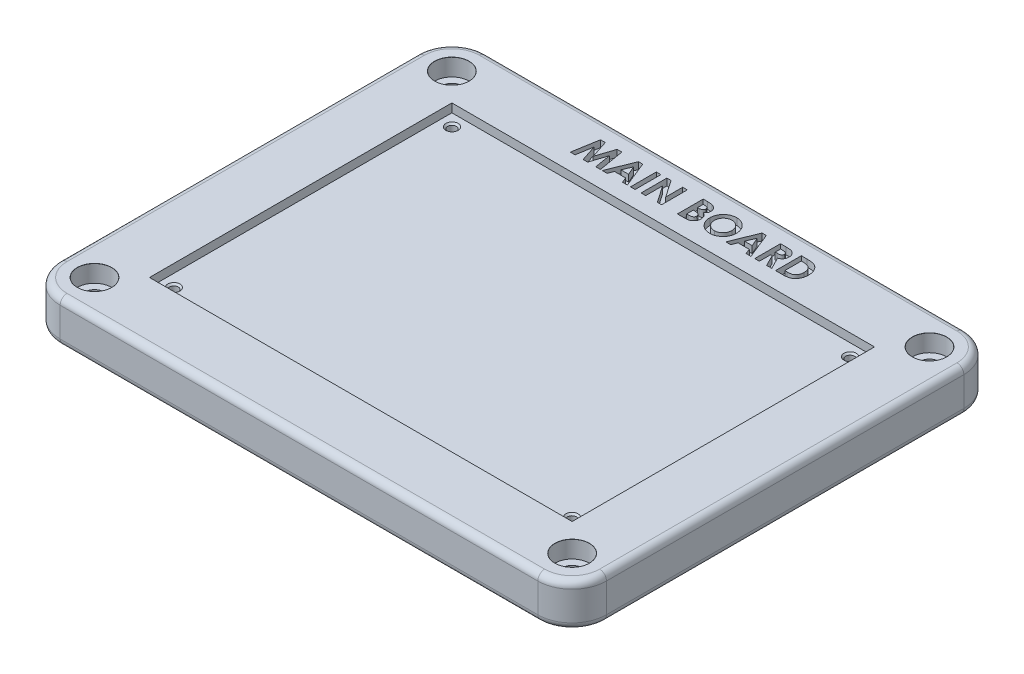
from build123d import *

# Parameters (mm, degrees)
SKETCH1_W           = 123
SKETCH1_H           = 88
SKETCH1_R           = 1.275
BOSS_EXTRUDE1_DEPTH = 10
SKETCH1_3_W         = 159
SKETCH1_3_H         = 124
SKETCH1_3_W_2       = 123
SKETCH1_3_H_2       = 88
BOSS_EXTRUDE2_DEPTH = 12.5
FILLET1_R           = 10
FILLET2_R           = 2
SKETCH4_W           = 1.346153846
SKETCH4_H           = 7.5
CUT_EXTRUDE1_DEPTH  = 2
CHAMFER1_SIZE       = 0.5


# Read off the part's stored shape, not the designer's step: CBORE for M5 SHCS1
with BuildPart() as part:
    # Sketch1 → Boss-Extrude1 (new body)
    with BuildSketch(Plane(origin=(0, 0, 0), x_dir=(1, 0, 0), z_dir=(0, 1, 0))):
        Rectangle(SKETCH1_W, SKETCH1_H)
        with Locations(Location((57.925, 40.475, 0), (0, 0, 270))):
            Circle(SKETCH1_R, mode=Mode.SUBTRACT)
        with Locations(Location((-57.925, 40.475, 0), (0, 0, 270))):
            Circle(SKETCH1_R, mode=Mode.SUBTRACT)
        with Locations(Location((-57.925, -40.475, 0), (0, 0, 270))):
            Circle(SKETCH1_R, mode=Mode.SUBTRACT)
        with Locations(Location((57.925, -40.475, 0), (0, 0, 270))):
            Circle(SKETCH1_R, mode=Mode.SUBTRACT)
    extrude(amount=BOSS_EXTRUDE1_DEPTH)

    # Sketch1<3> → Boss-Extrude2 (add)
    with BuildSketch(Plane(origin=(0, 0, 0), x_dir=(1, 0, 0), z_dir=(0, 1, 0))):
        Rectangle(SKETCH1_3_W, SKETCH1_3_H)
        Rectangle(SKETCH1_3_W_2, SKETCH1_3_H_2, mode=Mode.SUBTRACT)
    extrude(amount=BOSS_EXTRUDE2_DEPTH)

    # CBORE for M5 SHCS1 outline → CBORE for M5 SHCS1 (revolve, cut)
    with BuildSketch(Plane(origin=(69.5, 0, 52), x_dir=(1, 0, 0), z_dir=(0, 0, 1))):
        Polygon((0, 0), (2.75, 0), (2.75, 7.5), (5, 7.5), (5, 12.475), (5.025, 12.5), (0, 12.5), align=None)
    revolve(axis=Axis((69.5, 0, 52), (0, 1, 0)), mode=Mode.SUBTRACT)

    # CBORE for M5 SHCS1 2 outline → CBORE for M5 SHCS1 2 (revolve, cut)
    with BuildSketch(Plane(origin=(-69.5, 0, -52), x_dir=(1, 0, 0), z_dir=(0, 0, 1))):
        Polygon((0, 12.5), (0, 0), (2.75, 0), (2.75, 7.5), (5, 7.5), (5, 12.475), (5.025, 12.5), align=None)
    revolve(axis=Axis((-69.5, 0, -52), (0, 1, 0)), mode=Mode.SUBTRACT)

    # CBORE for M5 SHCS1 3 outline → CBORE for M5 SHCS1 3 (revolve, cut)
    with BuildSketch(Plane(origin=(-69.5, 0, 52), x_dir=(1, 0, 0), z_dir=(0, 0, 1))):
        Polygon((0, 12.5), (0, 0), (2.75, 0), (2.75, 7.5), (5, 7.5), (5, 12.475), (5.025, 12.5), align=None)
    revolve(axis=Axis((-69.5, 0, 52), (0, 1, 0)), mode=Mode.SUBTRACT)

    # CBORE for M5 SHCS1 4 outline → CBORE for M5 SHCS1 4 (revolve, cut)
    with BuildSketch(Plane(origin=(69.5, 0, -52), x_dir=(1, 0, 0), z_dir=(0, 0, 1))):
        Polygon((0, 12.5), (0, 0), (2.75, 0), (2.75, 7.5), (5, 7.5), (5, 12.475), (5.025, 12.5), align=None)
    revolve(axis=Axis((69.5, 0, -52), (0, 1, 0)), mode=Mode.SUBTRACT)

    # Fillet1
    fillet1_edges = [part.edges().sort_by_distance(p)[0] for p in [
        (-79.5, 6.25, 62),
        (79.5, 6.25, 62),
        (79.5, 6.25, -62),
        (-79.5, 6.25, -62),
    ]]
    fillet(fillet1_edges, radius=FILLET1_R)

    # Fillet2
    fillet2_edges = [part.edges().sort_by_distance(p)[0] for p in [
        (0, 12.5, 62),
        (0, 12.5, -62),
        (-79.5, 12.5, 0),
        (-76.571067812, 12.5, 59.071067812),
        (-76.571067812, 12.5, -59.071067812),
        (76.571067812, 12.5, -59.071067812),
        (76.571067812, 12.5, 59.071067812),
        (79.5, 0, 0),
        (79.5, 12.5, 0),
        (0, 0, 62),
        (-79.5, 0, 0),
        (0, 0, -62),
        (-76.571067812, 0, 59.071067812),
        (-76.571067812, 0, -59.071067812),
        (76.571067812, 0, -59.071067812),
        (76.571067812, 0, 59.071067812),
    ]]
    fillet(fillet2_edges, radius=FILLET2_R)

    # Sketch4 → Cut-Extrude1 (cut)
    # profile 1 of 9: a face of its own
    with BuildSketch(Plane(origin=(0, 12.5, 0), x_dir=(1, 0, 0), z_dir=(0, 1, 0))):
        Polygon((-30.584937428, 56.338544562), (-29.187701851, 56.338544562), (-27.47646387, 51.10717437), (-25.753206659, 56.338544562), (-24.369492717, 56.338544562), (-23.10146387, 48.838544562), (-24.464144159, 48.838544562), (-25.264925409, 53.575623889), (-26.824420601, 48.838544562), (-28.137521563, 48.838544562), (-29.688002332, 53.575623889), (-30.487281178, 48.838544562), (-31.85146387, 48.838544562), align=None)
    # profile 2 of 9: a face of its own
    with BuildSketch(Plane(origin=(0, 12.5, 0), x_dir=(1, 0, 0), z_dir=(0, 1, 0))):
        Polygon((-19.542269159, 56.338544562), (-18.293771563, 56.338544562), (-15.264925409, 48.838544562), (-16.70272589, 48.838544562), (-17.285658582, 50.377006101), (-20.553386947, 50.377006101), (-21.13631964, 48.838544562), (-22.572617717, 48.838544562), align=None)
        Polygon((-18.918771563, 54.326825812), (-20.04256964, 51.723159947), (-17.794973486, 51.723159947), align=None, mode=Mode.SUBTRACT)
    # profile 3 of 9: a face of its own
    with BuildSketch(Plane(origin=(0, 12.5, 0), x_dir=(1, 0, 0), z_dir=(0, 1, 0))):
        with Locations((-13.678386947, 52.588544562)):
            Rectangle(SKETCH4_W, SKETCH4_H)
    # profile 4 of 9: a face of its own
    with BuildSketch(Plane(origin=(0, 12.5, 0), x_dir=(1, 0, 0), z_dir=(0, 1, 0))):
        Polygon((-11.274540794, 56.338544562), (-10.06210089, 56.338544562), (-6.659156178, 51.403147928), (-6.659156178, 56.338544562), (-5.313002332, 56.338544562), (-5.313002332, 48.838544562), (-6.534456659, 48.838544562), (-9.928386947, 53.758917159), (-9.928386947, 48.838544562), (-11.274540794, 48.838544562), align=None)
    # profile 5 of 9: a face of its own
    with BuildSketch(Plane(origin=(0, 12.5, 0), x_dir=(1, 0, 0), z_dir=(0, 1, 0))):
        with BuildLine():
            Line((-0.697617717, 48.838544562), (-0.697617717, 56.338544562))
            Line((-0.697617717, 56.338544562), (0.50430536, 56.338544562))
            add(Edge.make_bspline(
                [(0.50430536, 56.338544562), (0.588447491, 56.338554165), (0.751260919, 56.338572746), (0.986158204, 56.330323925), (1.204005599, 56.31965315), (1.404109828, 56.307715035), (1.586811483, 56.287143276), (1.751832735, 56.26546289), (1.899503299, 56.239317681), (1.990799984, 56.215864619), (2.033752476, 56.20483062)],
                knots=[0, 0, 0, 0, 1.311965854, 2.538629056, 3.664479157, 4.713267157, 5.663616078, 6.530575999, 7.308677837, 8, 8, 8, 8], degree=3))
            add(Edge.make_bspline(
                [(2.033752476, 56.20483062), (2.090153458, 56.189266969), (2.200830292, 56.158726089), (2.359354837, 56.097047461), (2.509737481, 56.028487294), (2.651794611, 55.950272966), (2.784653939, 55.861460211), (2.907810555, 55.761344185), (3.023920642, 55.65394354), (3.128861396, 55.53626505), (3.223710548, 55.411915928), (3.306117455, 55.280928754), (3.377718495, 55.14530641), (3.435018081, 55.003342178), (3.478192244, 54.855689841), (3.509769646, 54.702979898), (3.530236078, 54.544729137), (3.532169887, 54.437065972), (3.533151514, 54.382414755)],
                knots=[0, 0, 0, 0, 1.099996261, 2.158545794, 3.195537121, 4.207578794, 5.205712374, 6.197378256, 7.190519799, 8.17788031, 9.159561366, 10.129234751, 11.085776129, 12.040971148, 13.00380137, 13.975669004, 14.972423361, 16, 16, 16, 16], degree=3))
            add(Edge.make_bspline(
                [(3.533151514, 54.382414755), (3.530584852, 54.312202286), (3.525532693, 54.173997667), (3.493259155, 53.971000086), (3.432741244, 53.779138194), (3.353555029, 53.59487605), (3.245886533, 53.418900952), (3.109168367, 53.251296571), (2.945614917, 53.086902118), (2.820160393, 52.988358732), (2.754906322, 52.937102255)],
                knots=[0, 0, 0, 0, 0.986156485, 1.941127874, 2.875419072, 3.804401753, 4.751181392, 5.761612777, 6.835722519, 8, 8, 8, 8], degree=3))
            add(Edge.make_bspline(
                [(2.754906322, 52.937102255), (2.80778509, 52.910108102), (2.911465725, 52.857180037), (3.058661768, 52.770182098), (3.194949235, 52.677648756), (3.320939199, 52.581441819), (3.433988877, 52.477482937), (3.538766278, 52.371762361), (3.630102231, 52.258222744), (3.711777592, 52.140910853), (3.782768489, 52.018127999), (3.844593732, 51.890081534), (3.896815297, 51.756334023), (3.941037869, 51.617566133), (3.974019075, 51.473300567), (3.995523522, 51.323485731), (4.011988672, 51.168632568), (4.013269505, 51.063150461), (4.013920745, 51.00951812)],
                knots=[0, 0, 0, 0, 1.164658916, 2.283573913, 3.35186032, 4.395461096, 5.390182219, 6.362969632, 7.312859996, 8.245001507, 9.165155236, 10.092416118, 11.032087915, 11.979892451, 12.947605196, 13.931445124, 14.948243989, 16, 16, 16, 16], degree=3))
            add(Edge.make_bspline(
                [(4.013920745, 51.00951812), (4.009694636, 50.907083415), (4.001354426, 50.704928936), (3.940374881, 50.408119733), (3.834655727, 50.126717688), (3.692696703, 49.861841213), (3.517775872, 49.621158048), (3.316667079, 49.410321684), (3.091395026, 49.231853383), (2.88355433, 49.111401125), (2.703788496, 49.030566396), (2.554891814, 48.980589269), (2.394979933, 48.934290534), (2.221123653, 48.901778606), (2.03647475, 48.872020115), (1.839232886, 48.853646606), (1.629766702, 48.841195332), (1.485896272, 48.839446016), (1.411757283, 48.838544562)],
                knots=[0, 0, 0, 0, 1.284142165, 2.534249414, 3.780121997, 5.041676246, 6.291546858, 7.49970053, 8.684500223, 9.883330709, 10.50184324, 11.153274765, 11.851151195, 12.587658647, 13.369265475, 14.195992086, 15.070362669, 16, 16, 16, 16], degree=3))
            Line((1.411757283, 48.838544562), (-0.697617717, 48.838544562))
        make_face()
        with BuildLine():
            Line((0.64853613, 54.992390716), (0.64853613, 53.357775332))
            Line((0.64853613, 53.357775332), (1.006108245, 53.357775332))
            add(Edge.make_bspline(
                [(1.006108245, 53.357775332), (1.054705508, 53.358199118), (1.148519583, 53.359017212), (1.284024064, 53.369553982), (1.410021348, 53.387530366), (1.526033555, 53.412611943), (1.63314138, 53.444461889), (1.730660588, 53.482784233), (1.818162404, 53.529541658), (1.919819277, 53.599188907), (2.027277922, 53.701677951), (2.121872559, 53.849744611), (2.177588169, 54.020020706), (2.183793385, 54.140112592), (2.186997668, 54.202126293)],
                knots=[0, 0, 0, 0, 1.065314748, 2.056525647, 2.977365736, 3.853934255, 4.656397591, 5.425096493, 6.14721249, 6.826394842, 8.123232004, 9.372140726, 10.643011755, 12, 12, 12, 12], degree=3))
            add(Edge.make_bspline(
                [(2.186997668, 54.202126293), (2.184433655, 54.260212428), (2.179476238, 54.372519634), (2.123377783, 54.530208954), (2.036245792, 54.669953964), (1.933374229, 54.765597995), (1.836500663, 54.830920049), (1.753551571, 54.873931839), (1.662508714, 54.912435554), (1.5616096, 54.941876434), (1.451430418, 54.963967833), (1.332506369, 54.98019132), (1.204632269, 54.991233715), (1.116309356, 54.991996777), (1.07071161, 54.992390716)],
                knots=[0, 0, 0, 0, 1.347982417, 2.606269829, 3.849316587, 5.153353503, 5.842674298, 6.568177932, 7.326619318, 8.142485038, 9.012069166, 9.942760135, 10.937925643, 12, 12, 12, 12], degree=3))
            Line((1.07071161, 54.992390716), (0.64853613, 54.992390716))
        make_face(mode=Mode.SUBTRACT)
        with BuildLine():
            Line((0.64853613, 52.107775332), (0.64853613, 50.184698409))
            Line((0.64853613, 50.184698409), (1.036156322, 50.184698409))
            add(Edge.make_bspline(
                [(1.036156322, 50.184698409), (1.112789327, 50.18513621), (1.260125843, 50.185977938), (1.471185141, 50.196148015), (1.663090807, 50.214477785), (1.835334365, 50.237361028), (1.988179638, 50.268364242), (2.121109971, 50.307780855), (2.235948333, 50.351145995), (2.332006147, 50.404707092), (2.410479878, 50.467038927), (2.481294192, 50.530743559), (2.539031772, 50.604232871), (2.584714822, 50.68435217), (2.624253422, 50.769111235), (2.648100313, 50.861819877), (2.666256499, 50.959730434), (2.667255682, 51.027453049), (2.667766899, 51.062102255)],
                knots=[0, 0, 0, 0, 1.753078804, 3.370512758, 4.83203934, 6.162291463, 7.344201807, 8.395507345, 9.331626367, 10.147333109, 10.898971645, 11.62040215, 12.321813352, 13.025280112, 13.727906689, 14.453419512, 15.208716525, 16, 16, 16, 16], degree=3))
            add(Edge.make_bspline(
                [(2.667766899, 51.062102255), (2.66663952, 51.101724167), (2.664443689, 51.178896993), (2.64651031, 51.291693314), (2.613919503, 51.396996164), (2.572869791, 51.497498279), (2.515746936, 51.589601332), (2.447858376, 51.676492662), (2.365831663, 51.755229859), (2.27358784, 51.830575244), (2.165994552, 51.89654421), (2.043001321, 51.953783974), (1.90393998, 52.001588517), (1.748379773, 52.039650525), (1.577002662, 52.071953225), (1.388557783, 52.091241503), (1.184614571, 52.105587043), (1.043197029, 52.107029328), (0.970050553, 52.107775332)],
                knots=[0, 0, 0, 0, 0.845221588, 1.646264278, 2.427170338, 3.19324141, 3.95557735, 4.731569926, 5.540061037, 6.376114724, 7.268642756, 8.224665384, 9.265483498, 10.400594375, 11.639216012, 12.983232105, 14.439614077, 16, 16, 16, 16], degree=3))
            Line((0.970050553, 52.107775332), (0.64853613, 52.107775332))
        make_face(mode=Mode.SUBTRACT)
    # profile 6 of 9: a face of its own
    with BuildSketch(Plane(origin=(0, 12.5, 0), x_dir=(1, 0, 0), z_dir=(0, 1, 0))):
        with BuildLine():
            add(Edge.make_bspline(
                [(8.884714014, 56.530852255), (9.015110706, 56.527476051), (9.27254331, 56.52081066), (9.651133772, 56.465249423), (10.015975683, 56.374720352), (10.366904064, 56.248878397), (10.703040229, 56.084315116), (11.025569843, 55.885695987), (11.33333762, 55.649272194), (11.623189804, 55.380559112), (11.891065497, 55.088345369), (12.123179942, 54.773725323), (12.321118626, 54.444851095), (12.485170736, 54.100841458), (12.610126953, 53.739313981), (12.697813899, 53.362111976), (12.754148418, 52.969342753), (12.760627754, 52.701920447), (12.763920745, 52.566008505)],
                knots=[0, 0, 0, 0, 1.014329547, 2.002516266, 2.970391464, 3.935626869, 4.897733899, 5.877609409, 6.878433252, 7.912639331, 8.949961323, 9.958554974, 10.949718813, 11.932905612, 12.9188844, 13.919928257, 14.942845884, 16, 16, 16, 16], degree=3))
            add(Edge.make_bspline(
                [(12.763920745, 52.566008505), (12.760413852, 52.431627976), (12.753503408, 52.166826832), (12.700113721, 51.777677133), (12.610950116, 51.404515747), (12.488113254, 51.046498015), (12.327036429, 50.705358054), (12.132957765, 50.378917731), (11.900755897, 50.07020649), (11.638900137, 49.779389999), (11.35061967, 49.51541163), (11.045284892, 49.282781149), (10.72430565, 49.085658858), (10.388151755, 48.924135049), (10.036102341, 48.798782369), (9.669027013, 48.710336945), (9.286948486, 48.656586875), (9.027116559, 48.649721568), (8.895230841, 48.64623687)],
                knots=[0, 0, 0, 0, 1.051557043, 2.072126891, 3.067553643, 4.050577992, 5.02905126, 6.015227836, 7.017913613, 8.04756643, 9.074058332, 10.072836633, 11.047628519, 12.017157415, 12.98668631, 13.966869689, 14.968021931, 16, 16, 16, 16], degree=3))
            add(Edge.make_bspline(
                [(8.895230841, 48.64623687), (8.757294194, 48.649362816), (8.486267537, 48.655504873), (8.089618811, 48.713913029), (7.709595058, 48.801896115), (7.349388697, 48.93320615), (7.005331333, 49.097354737), (6.679950858, 49.299513562), (6.373356619, 49.539348543), (6.087307293, 49.810717418), (5.828145911, 50.107654487), (5.599385156, 50.421342168), (5.406420385, 50.749384163), (5.249244537, 51.091934003), (5.125333412, 51.446862825), (5.037928193, 51.816332246), (4.986295844, 52.199456145), (4.979103757, 52.459681556), (4.975459206, 52.59154937)],
                knots=[0, 0, 0, 0, 1.067978421, 2.098431617, 3.099715153, 4.085208694, 5.062210972, 6.048429807, 7.046490867, 8.072918869, 9.098532598, 10.095778865, 11.076610158, 12.041847152, 13.011192615, 13.984257998, 14.978533688, 16, 16, 16, 16], degree=3))
            add(Edge.make_bspline(
                [(4.975459206, 52.59154937), (4.976603076, 52.680263132), (4.978876332, 52.856567336), (5.006260095, 53.117841167), (5.045684839, 53.374015283), (5.103992166, 53.624068315), (5.174820665, 53.86976427), (5.266588991, 54.108816151), (5.371046181, 54.343777687), (5.493094572, 54.57187369), (5.628800581, 54.791005485), (5.77686792, 55.00013939), (5.937668902, 55.19674667), (6.110685532, 55.382119346), (6.296514051, 55.555038952), (6.492710075, 55.717953404), (6.703078666, 55.866535116), (6.923015514, 56.004412748), (7.151280667, 56.129093101), (7.386944878, 56.235217288), (7.625152999, 56.327893733), (7.86908717, 56.401038081), (8.1161332, 56.460613387), (8.368930278, 56.50001156), (8.625194526, 56.527394564), (8.798002221, 56.529696956), (8.884714014, 56.530852255)],
                knots=[0, 0, 0, 0, 1.034744296, 2.056386356, 3.06226378, 4.057406941, 5.050368692, 6.043467995, 7.042652155, 8.049140477, 9.059438543, 10.048523776, 11.036952808, 12.020949711, 13.004946614, 13.997082645, 14.994316842, 16.007702937, 17.024872941, 18.026463647, 19.021641123, 20.005082605, 20.995858141, 21.984425357, 22.988620895, 24, 24, 24, 24], degree=3))
        make_face()
        with BuildLine():
            add(Edge.make_bspline(
                [(8.86368036, 55.184698409), (8.775923404, 55.182343692), (8.602726289, 55.177696425), (8.348677664, 55.142290533), (8.104782013, 55.085743298), (7.872391344, 55.003835319), (7.650498458, 54.899587251), (7.438710006, 54.773363349), (7.23995882, 54.620824806), (7.051594747, 54.450160738), (6.881438802, 54.260001746), (6.731100658, 54.056214045), (6.605291845, 53.839137958), (6.499926176, 53.610790071), (6.42060918, 53.368602673), (6.364114062, 53.114472842), (6.328411256, 52.847962702), (6.323910873, 52.666283086), (6.321613053, 52.573520524)],
                knots=[0, 0, 0, 0, 1.033739768, 2.040188636, 3.016340934, 3.979330865, 4.937572243, 5.900995986, 6.878200029, 7.884839167, 8.891893314, 9.879764717, 10.863503415, 11.843163062, 12.837761627, 13.859916423, 14.907309254, 16, 16, 16, 16], degree=3))
            add(Edge.make_bspline(
                [(6.321613053, 52.573520524), (6.324659611, 52.470718739), (6.330630361, 52.269244274), (6.372641284, 51.975338752), (6.444517791, 51.697774157), (6.54830607, 51.437908015), (6.677030765, 51.192854708), (6.836886407, 50.965617712), (7.02528409, 50.754836438), (7.170424138, 50.631773551), (7.244089014, 50.569313793)],
                knots=[0, 0, 0, 0, 1.078454662, 2.113592447, 3.107694534, 4.079536787, 5.043276885, 6.005368276, 6.987637804, 8, 8, 8, 8], degree=3))
            add(Edge.make_bspline(
                [(7.244089014, 50.569313793), (7.304434611, 50.523170923), (7.423766208, 50.431924789), (7.614245418, 50.31497415), (7.810401496, 50.214735786), (8.013714688, 50.133744373), (8.223755605, 50.07003789), (8.440495445, 50.025425287), (8.663627106, 49.99742702), (8.814519191, 49.994080697), (8.89072363, 49.992390716)],
                knots=[0, 0, 0, 0, 1.023928204, 2.024787132, 3.009472467, 3.9914905, 4.972207045, 5.96565515, 6.972602802, 8, 8, 8, 8], degree=3))
            add(Edge.make_bspline(
                [(8.89072363, 49.992390716), (8.976971603, 49.994765398), (9.146667203, 49.999437659), (9.395986575, 50.034407685), (9.634842107, 50.093589596), (9.864716633, 50.174779048), (10.084947297, 50.280336041), (10.294457773, 50.410475013), (10.493615389, 50.563598026), (10.681739489, 50.736503287), (10.853693809, 50.927411374), (11.003718229, 51.132286058), (11.133527134, 51.346613334), (11.236701722, 51.573426681), (11.319152353, 51.810585087), (11.374967523, 52.059138875), (11.410971937, 52.318063412), (11.415473588, 52.49427071), (11.417766899, 52.584037351)],
                knots=[0, 0, 0, 0, 1.026359118, 2.019393844, 2.989460624, 3.950973911, 4.916101784, 5.890408035, 6.881132271, 7.902007068, 8.92769091, 9.933912415, 10.920395702, 11.90457117, 12.894218921, 13.903490204, 14.931958862, 16, 16, 16, 16], degree=3))
            add(Edge.make_bspline(
                [(11.417766899, 52.584037351), (11.415394239, 52.673287809), (11.41072402, 52.848963725), (11.375692445, 53.107222569), (11.31688585, 53.354679065), (11.235452594, 53.591737335), (11.131466638, 53.818629785), (11.002877455, 54.034558527), (10.850136248, 54.23931481), (10.676758346, 54.431503298), (10.488047155, 54.608112208), (10.285446836, 54.761376638), (10.074626373, 54.894558555), (9.850748517, 54.99888789), (9.618393619, 55.08200685), (9.37614384, 55.143216846), (9.123081642, 55.177447697), (8.950918196, 55.182259961), (8.86368036, 55.184698409)],
                knots=[0, 0, 0, 0, 1.055025985, 2.07665775, 3.074803781, 4.057872707, 5.035505728, 6.020516407, 7.023567878, 8.050795229, 9.077271434, 10.074415901, 11.050397877, 12.019801805, 12.988065821, 13.964604439, 14.968634123, 16, 16, 16, 16], degree=3))
        make_face(mode=Mode.SUBTRACT)
    # profile 7 of 9: a face of its own
    with BuildSketch(Plane(origin=(0, 12.5, 0), x_dir=(1, 0, 0), z_dir=(0, 1, 0))):
        Polygon((16.419269303, 56.338544562), (17.667766899, 56.338544562), (20.696613053, 48.838544562), (19.258812572, 48.838544562), (18.67587988, 50.377006101), (15.408151514, 50.377006101), (14.825218822, 48.838544562), (13.388920745, 48.838544562), align=None)
        Polygon((17.042766899, 54.326825812), (15.918968822, 51.723159947), (18.166564976, 51.723159947), align=None, mode=Mode.SUBTRACT)
    # profile 8 of 9: a face of its own
    with BuildSketch(Plane(origin=(0, 12.5, 0), x_dir=(1, 0, 0), z_dir=(0, 1, 0))):
        with BuildLine():
            Line((21.802382283, 56.338544562), (23.370891899, 56.338544562))
            add(Edge.make_bspline(
                [(23.370891899, 56.338544562), (23.474569907, 56.338176565), (23.673971921, 56.337468802), (23.961498734, 56.326302182), (24.225631654, 56.310762912), (24.466761752, 56.287049575), (24.684785869, 56.255608556), (24.879922518, 56.218544797), (25.052165992, 56.176302697), (25.20296893, 56.123665709), (25.339061124, 56.064291984), (25.465917969, 55.996070485), (25.586338116, 55.91976088), (25.699516687, 55.833355258), (25.806437229, 55.738408033), (25.907301455, 55.634823632), (26.000684059, 55.521723702), (26.086006813, 55.399822892), (26.163771636, 55.271586034), (26.232499429, 55.13683706), (26.288388984, 54.99548226), (26.337773398, 54.849564517), (26.373343391, 54.696997907), (26.398081801, 54.539267694), (26.416194297, 54.375818648), (26.417235679, 54.264778624), (26.417766899, 54.208135909)],
                knots=[0, 0, 0, 0, 1.749336639, 3.364467119, 4.854658419, 6.213483162, 7.451590619, 8.570285859, 9.5643256, 10.440900261, 11.26203566, 12.067320669, 12.869050712, 13.665104639, 14.467235401, 15.27997916, 16.102287765, 16.939272006, 17.78853747, 18.631303466, 19.488103222, 20.351255419, 21.228522269, 22.127379805, 23.044756219, 24, 24, 24, 24], degree=3))
            add(Edge.make_bspline(
                [(26.417766899, 54.208135909), (26.41638698, 54.149013926), (26.41368121, 54.033086493), (26.399106463, 53.86279855), (26.372468404, 53.699878957), (26.332121189, 53.544804722), (26.285747305, 53.395645767), (26.224081936, 53.255154167), (26.154486471, 53.121286676), (26.071829972, 52.995936899), (25.981118501, 52.876320568), (25.875622969, 52.767020628), (25.762177866, 52.662162622), (25.634406029, 52.568314498), (25.497939759, 52.479130587), (25.350067615, 52.398306212), (25.191754662, 52.323809637), (25.080452816, 52.2822652), (25.02353613, 52.261020524)],
                knots=[0, 0, 0, 0, 1.099860209, 2.156625411, 3.176576793, 4.16617041, 5.135385252, 6.078461593, 7.016046972, 7.938469504, 8.868247731, 9.803980173, 10.76021508, 11.73834243, 12.748633912, 13.790971185, 14.870363756, 16, 16, 16, 16], degree=3))
            Line((25.02353613, 52.261020524), (26.75430536, 48.838544562))
            Line((26.75430536, 48.838544562), (25.25791113, 48.838544562))
            Line((25.25791113, 48.838544562), (23.605266899, 52.107775332))
            Line((23.605266899, 52.107775332), (23.14853613, 52.107775332))
            Line((23.14853613, 52.107775332), (23.14853613, 48.838544562))
            Line((23.14853613, 48.838544562), (21.802382283, 48.838544562))
            Line((21.802382283, 48.838544562), (21.802382283, 56.338544562))
        make_face()
        with BuildLine():
            Line((23.14853613, 53.453929178), (23.672875072, 53.453929178))
            add(Edge.make_bspline(
                [(23.672875072, 53.453929178), (23.736979866, 53.454651169), (23.859726773, 53.456033627), (24.036252946, 53.462446041), (24.196580811, 53.47789679), (24.341398869, 53.497418234), (24.471435831, 53.519958561), (24.585531815, 53.552260217), (24.685444864, 53.586872259), (24.769991005, 53.629886049), (24.842225285, 53.678802058), (24.904594963, 53.73437186), (24.95618363, 53.798686829), (24.998643733, 53.869999164), (25.031673078, 53.948939602), (25.055781969, 54.034641559), (25.069255274, 54.128081288), (25.070805423, 54.192567424), (25.071613053, 54.226164755)],
                knots=[0, 0, 0, 0, 1.688639943, 3.233382647, 4.650958383, 5.928841754, 7.082724185, 8.122798841, 9.049171256, 9.863274652, 10.613301712, 11.341792392, 12.054588806, 12.776240173, 13.521029143, 14.301969904, 15.115324896, 16, 16, 16, 16], degree=3))
            add(Edge.make_bspline(
                [(25.071613053, 54.226164755), (25.070086156, 54.26591285), (25.067086849, 54.343990618), (25.037324412, 54.456395225), (24.98994904, 54.56043338), (24.925010382, 54.655635012), (24.843228584, 54.739095335), (24.749377519, 54.812666274), (24.641431653, 54.870840668), (24.541481905, 54.909211878), (24.450550997, 54.93216977), (24.36848872, 54.949277787), (24.273460111, 54.96140273), (24.165393426, 54.974263391), (24.044564131, 54.982602878), (23.910313636, 54.988689041), (23.763027505, 54.99117919), (23.660355083, 54.991975246), (23.606769303, 54.992390716)],
                knots=[0, 0, 0, 0, 1.020303359, 2.004196876, 2.966617323, 3.9489082, 4.950758222, 5.960522915, 7.003732012, 8.091992268, 8.70421221, 9.413913587, 10.24622431, 11.166358409, 12.212345909, 13.359657661, 14.621978493, 16, 16, 16, 16], degree=3))
            Line((23.606769303, 54.992390716), (23.14853613, 54.992390716))
            Line((23.14853613, 54.992390716), (23.14853613, 53.453929178))
        make_face(mode=Mode.SUBTRACT)
    # profile 9 of 9: a face of its own
    with BuildSketch(Plane(origin=(0, 12.5, 0), x_dir=(1, 0, 0), z_dir=(0, 1, 0))):
        with BuildLine():
            Line((27.860074591, 56.338544562), (29.556288533, 56.338544562))
            add(Edge.make_bspline(
                [(29.556288533, 56.338544562), (29.68852792, 56.337620164), (29.94414815, 56.335833291), (30.314491292, 56.315699531), (30.658863288, 56.284735237), (30.977486125, 56.242138239), (31.269706576, 56.185770746), (31.535147829, 56.115068773), (31.774700767, 56.033455109), (31.99099204, 55.937420071), (32.188445168, 55.825452754), (32.375933215, 55.700730152), (32.553088052, 55.558683313), (32.722395768, 55.402052601), (32.88167141, 55.227972507), (33.033567489, 55.039326428), (33.174364898, 54.833378735), (33.30831964, 54.615067404), (33.42946388, 54.383467253), (33.535130412, 54.140549614), (33.623647907, 53.887877753), (33.695572955, 53.625182387), (33.75290552, 53.353335584), (33.79301996, 53.071788784), (33.817819106, 52.780802652), (33.820334772, 52.583587063), (33.821613053, 52.483376293)],
                knots=[0, 0, 0, 0, 1.44355588, 2.790409838, 4.047694926, 5.217575253, 6.298404546, 7.294384826, 8.214239204, 9.058592145, 9.873746385, 10.689560431, 11.514393297, 12.350027578, 13.205127629, 14.088021785, 14.991911688, 15.926770944, 16.882954281, 17.842803888, 18.816321264, 19.80318086, 20.814351908, 21.847355356, 22.906180909, 24, 24, 24, 24], degree=3))
            add(Edge.make_bspline(
                [(33.821613053, 52.483376293), (33.818265824, 52.341972374), (33.81167661, 52.063610483), (33.756172745, 51.655117614), (33.666404202, 51.263536457), (33.540181477, 50.891930111), (33.383699088, 50.543607785), (33.196763351, 50.224711998), (32.982115179, 49.936954421), (32.742255238, 49.681767851), (32.482545339, 49.462431535), (32.212654383, 49.274586032), (31.92995314, 49.126454178), (31.680853837, 49.032516431), (31.464853664, 48.97409528), (31.275207849, 48.939567816), (31.059789553, 48.90790405), (30.816590189, 48.883434973), (30.546676617, 48.861614569), (30.248972961, 48.849758211), (29.924443099, 48.839907338), (29.699026426, 48.839010724), (29.581829399, 48.838544562)],
                knots=[0, 0, 0, 0, 1.315458931, 2.589557908, 3.828601765, 5.048913369, 6.235739168, 7.376350998, 8.481830359, 9.569842114, 10.627874879, 11.640079404, 12.624025415, 13.590060155, 14.111227486, 14.704434459, 15.382649715, 16.137166398, 16.978595427, 17.902333227, 18.909396075, 20, 20, 20, 20], degree=3))
            Line((29.581829399, 48.838544562), (27.860074591, 48.838544562))
            Line((27.860074591, 48.838544562), (27.860074591, 56.338544562))
        make_face()
        with BuildLine():
            Line((29.206228437, 54.992390716), (29.206228437, 50.184698409))
            Line((29.206228437, 50.184698409), (29.909353437, 50.184698409))
            add(Edge.make_bspline(
                [(29.909353437, 50.184698409), (29.993014514, 50.18485171), (30.153922615, 50.185146561), (30.38623749, 50.199190533), (30.601069845, 50.213286808), (30.797828295, 50.240042011), (30.977944788, 50.269845423), (31.138944995, 50.311320953), (31.284147829, 50.354887483), (31.411779666, 50.410353075), (31.52868003, 50.472783291), (31.636916415, 50.545927527), (31.741394829, 50.627151442), (31.840161966, 50.718843947), (31.933591635, 50.819790862), (32.021131046, 50.930512321), (32.10394862, 51.050670509), (32.179918587, 51.180900733), (32.249340349, 51.319827732), (32.31092523, 51.466105796), (32.361988185, 51.620953106), (32.404428587, 51.782920104), (32.434757066, 51.953416898), (32.459848098, 52.13118064), (32.472783256, 52.316915617), (32.474558526, 52.443295903), (32.475459206, 52.507414755)],
                knots=[0, 0, 0, 0, 1.50275155, 2.890291501, 4.180787663, 5.369391935, 6.45668281, 7.458360028, 8.354766181, 9.177074746, 9.954075863, 10.732690366, 11.5210699, 12.329727389, 13.151100085, 13.990027547, 14.863562427, 15.770965086, 16.696477834, 17.652329173, 18.619756807, 19.62365428, 20.657822005, 21.729286259, 22.847956731, 24, 24, 24, 24], degree=3))
            add(Edge.make_bspline(
                [(32.475459206, 52.507414755), (32.473665357, 52.605670834), (32.470167488, 52.797262574), (32.436434805, 53.076320126), (32.38152443, 53.339094616), (32.303172617, 53.584610817), (32.204407727, 53.813558759), (32.080780445, 54.023998767), (31.937611213, 54.219465945), (31.82439689, 54.334133263), (31.767826995, 54.391429178)],
                knots=[0, 0, 0, 0, 1.13821349, 2.219428113, 3.251817212, 4.244760574, 5.201143372, 6.134805572, 7.068016741, 8, 8, 8, 8], degree=3))
            add(Edge.make_bspline(
                [(31.767826995, 54.391429178), (31.712043722, 54.440253043), (31.598112703, 54.539970259), (31.398087273, 54.659456985), (31.177669609, 54.764437785), (30.931817215, 54.847675852), (30.662906146, 54.913504064), (30.369334761, 54.958904172), (30.0526752, 54.9880778), (29.833300834, 54.990922277), (29.720050553, 54.992390716)],
                knots=[0, 0, 0, 0, 0.813307809, 1.661089106, 2.549956539, 3.493439533, 4.508053171, 5.589449661, 6.755572447, 8, 8, 8, 8], degree=3))
            Line((29.720050553, 54.992390716), (29.206228437, 54.992390716))
        make_face(mode=Mode.SUBTRACT)
    extrude(amount=-CUT_EXTRUDE1_DEPTH, mode=Mode.SUBTRACT)

    # Chamfer1
    chamfer1_edges = [part.edges().sort_by_distance(p)[0] for p in [
        (-57.925, 10, -41.75),
        (57.925, 10, -41.75),
        (-57.925, 10, 39.2),
        (57.925, 10, 39.2),
    ]]
    chamfer(chamfer1_edges, length=CHAMFER1_SIZE)


solid = part.part
